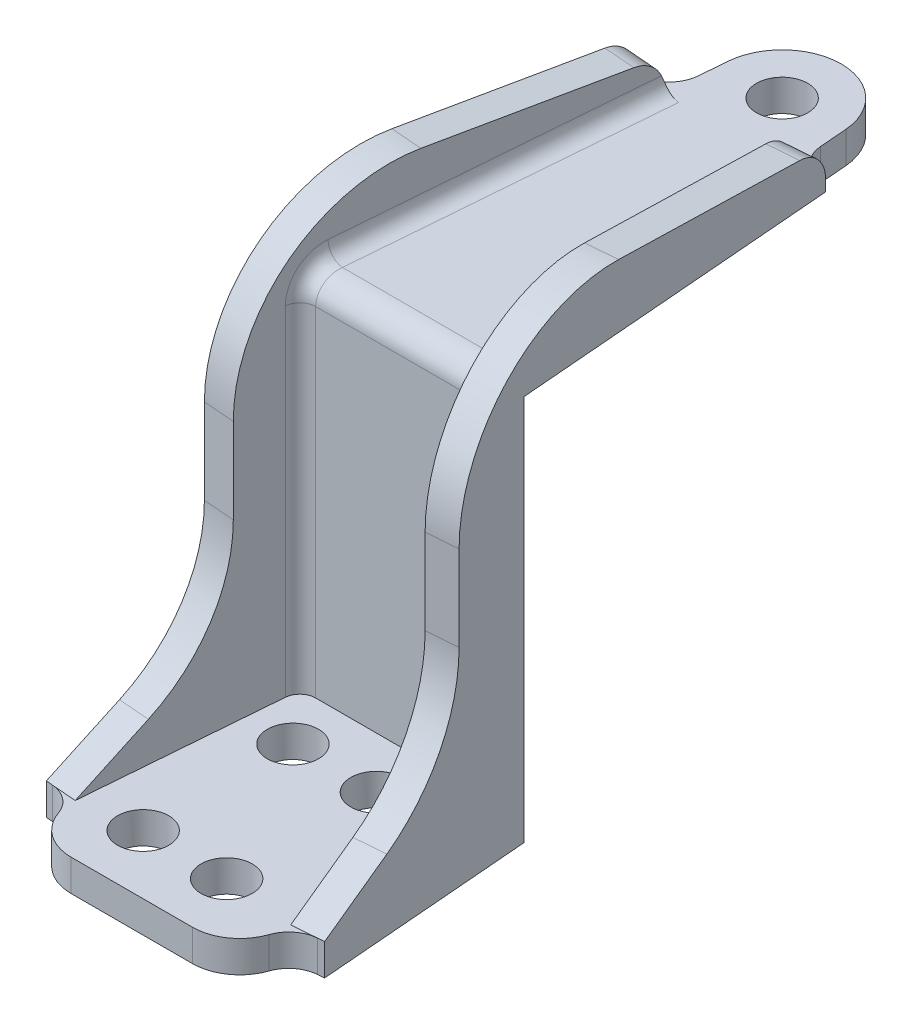
from build123d import *

# Parameters (mm, degrees)
EXTRUDE_THIN1_DEPTH = 15
SKETCH2_R           = 3.25
SKETCH2_R_2         = 3.250000000000001
SKETCH2_R_3         = 3.2500000000000004
CUT_EXTRUDE1_DEPTH  = 105.04326023342406
FILLET1_R           = 6
BOSS_EXTRUDE1_DEPTH = 4
FILLET2_R           = 4
FILLET3_R           = 2
CHAMFER1_SIZE       = 3


with BuildPart() as part:
    # Sketch1 → Extrude-Thin1 (new, symmetric)
    with BuildSketch(Plane(origin=(0, 0, 0), x_dir=(0, 0, -1), z_dir=(1, 0, 0))):
        with BuildLine():
            Line((-2.6e-16, 2), (-54, 1.9999999999999931))
            ThreePointArc((-53.99999999999915, 1.999999999999993), (-56.12132034355961, 1.121320343560103), (-56.99999999999909, -0.9999999999999665))
            Line((-56.99999999999999, -1.0000000000000062), (-56.999999999999986, -44))
            Line((-56.999999999999986, -44), (-90, -44.000000000000014))
            Line((-90, -44.000000000000014), (-90, -48.000000000000014))
            Line((-90, -48.000000000000014), (-55.99999999999999, -48))
            ThreePointArc((-55.999999999996966, -47.99999999999706), (-53.878679656439246, -47.12132034355912), (-52.999999999999986, -45.00000000000012))
            Line((-52.999999999999986, -45.00000000000001), (-52.99999999999999, -2.000000000000007))
            Line((-52.99999999999999, -2.000000000000007), (2.6e-16, -2))
            Line((2.6e-16, -2), (-2.6e-16, 2))
        make_face()
    extrude(amount=EXTRUDE_THIN1_DEPTH, both=True)

    # Sketch2 → Cut-Extrude1 (cut, through all)
    with BuildSketch(Plane(origin=(0, 2, 2.6e-16), x_dir=(1, 0, 0), z_dir=(0, 1, 1.2e-16))):
        with Locations(Location((0, -7.500000000000001, 0), (0, 0, 270))):
            Circle(SKETCH2_R)
        with Locations(Location((-6.061254587116736, -82.49999999999999, 0), (0, 0, 270))):
            Circle(SKETCH2_R_2)
        with Locations(Location((-6.061254587116736, -63.5, 0), (0, 0, 270))):
            Circle(SKETCH2_R_2)
        with Locations(Location((4.525736758380498, -82.49999999999999, 0), (0, 0, 270))):
            Circle(SKETCH2_R_3)
        with Locations(Location((4.525736758380496, -63.5, 0), (0, 0, 270))):
            Circle(SKETCH2_R_3)
        with BuildLine():
            Line((-7.475626789472967, -6.89584430440979), (-15, -100))
            Line((-15, -100), (-17.60021430999359, 8.448336275336032))
            Line((-17.60021430999359, 8.448336275336032), (38.42658286927368, 9.42947630958571))
            Line((38.42658286927368, 9.42947630958571), (15, -100))
            Line((15, -100), (7.475626789472967, -6.89584430440979))
            ThreePointArc((7.475626789472967, -6.89584430440979), (4.6e-16, -1.78e-15), (-7.475626789472967, -6.89584430440979))
        make_face()
    extrude(amount=-CUT_EXTRUDE1_DEPTH, mode=Mode.SUBTRACT)

    # Fillet1
    fillet1_edges = [part.edges().sort_by_distance(p)[0] for p in [
        (-14.19183272171777, -46.000000000000014, 90),
        (14.191832721717766, -46.000000000000014, 90),
    ]]
    fillet(fillet1_edges, radius=FILLET1_R)

    # Sketch8 → Boss-Extrude1 (add)
    with BuildSketch(Plane(origin=(6.873434455744054, 7e-17, -0.5554884816549988), x_dir=(-0.08055409274536145, 0, -0.9967502385963958), z_dir=(0.9967502385963958, 0, -0.08055409274536145))):
        with BuildLine():
            Line((-56.739879552269116, -48.000000000000014), (-84.3462691752867, -48.000000000000014))
            Line((-84.3462691752867, -48.000000000000014), (-84.3462691752867, -44.000000000000014))
            Line((-84.3462691752867, -44.000000000000014), (-75.73009848191336, -39.025451530797135))
            ThreePointArc((-75.73009848191336, -39.025451530797135), (-68.4095904062246, -31.70494345510837), (-65.73009848191339, -21.70494345510838))
            Line((-65.73009848191339, -21.70494345510838), (-65.73009848191336, -10.883213245781832))
            ThreePointArc((-65.73009848191336, -10.883213245781832), (-59.11411389020946, 3.9784196238086604), (-43.64328532686411, 9.007619086122059))
            Line((-43.64328532686411, 9.007619086122059), (-18.558264158463114, 6.3758663622832925))
            ThreePointArc((-18.558264158463114, 6.3758663622832925), (-16.00330021555487, 5.074502977561734), (-14.975626789472969, 2.397699895902515))
            Line((-14.975626789472969, 2.397699895902515), (-14.975626789472969, 1.9999999999999996))
            Line((-14.975626789472969, 1.9999999999999996), (-14.975626789472969, -2.000000000000003))
            Line((-14.975626789472969, -2.000000000000003), (-53.73009848191338, -2.000000000000007))
            Line((-53.73009848191338, -2.000000000000007), (-53.73009848191337, -45.00000000000001))
            add(Edge.make_bspline(
                [(-56.739879552269116, -48.000000000000014), (-53.73009848191338, -48.00000000000001), (-53.73009848191337, -45.00000000000001)],
                knots=[4.7123889803846915, 4.7123889803846915, 4.7123889803846915, 6.283185307179586, 6.283185307179586, 6.283185307179586], degree=2, weights=[1, 0.7071067811865481, 1]))
        make_face()
    boss_extrude1 = extrude(amount=BOSS_EXTRUDE1_DEPTH)

    # Mirror1: Boss-Extrude1 across plane
    add(boss_extrude1.mirror(Plane(origin=(0, 0, 0), x_dir=(0, 0, 1), z_dir=(1, 0, 0))))

    # Fillet2
    # the kernel refuses this fillet: 4 mm, written as the material it adds along each edge
    with BuildSketch(Plane(origin=(-8.079782485063179, -2.000000000000003, 14.371471093882759), x_dir=(-0.9967502385963957, 0, -0.08055409274536145), z_dir=(0, 1, 0))) as fillet2_piece_1:
        with BuildLine():
            CenterArc((FILLET2_R, -FILLET2_R), FILLET2_R, 90.00000000000001, 89.99999999999999)
            Line((-1.67e-15, -FILLET2_R), (0, 0))
            Line((0, 0), (FILLET2_R, -4e-17))
        make_face()
    extrude(amount=4.000000000000001)
    with BuildSketch(Plane(origin=(8.079782485063179, -2.000000000000003, 14.371471093882759), x_dir=(0.9967502385963957, 0, -0.08055409274536145), z_dir=(0, 1, 0))) as fillet2_piece_2:
        with BuildLine():
            CenterArc((FILLET2_R, FILLET2_R), FILLET2_R, 180.00000000000009, 89.99999999999989)
            Line((-2.09e-15, FILLET2_R), (0, 0))
            Line((0, 0), (FILLET2_R, 4e-17))
        make_face()
    extrude(amount=4.000000000000002)
    with BuildSketch(Plane(origin=(13.667871645615318, -48.00000000000001, 83.51667544352783), x_dir=(0.9967502385963959, 0, -0.08055409274535966), z_dir=(-1e-17, 1, 0))) as fillet2_piece_3_section:
        with BuildLine():
            CenterArc((3.165151389911689, -3.9999999999999964), FILLET2_R, 90.00000000000013, 66.4218215217981)
            ThreePointArc((-0.5009091660529862, -2.3999999999999995), (-0.12656212241577908, -1.2258578621353275), (0, 0))
            Line((0, 0), (3.16515138991168, 2e-17))
        make_face()
    fillet2_piece_3 = extrude(amount=4, mode=Mode.PRIVATE)
    fillet2_piece_3 = split(fillet2_piece_3, bisect_by=Plane(origin=(14.509633242445906, -44.745341237819986, 84.74382493773044), z_dir=(-0.04027704637268085, -0.8660254037844379, -0.4983751192981995)), keep=Keep.TOP, mode=Mode.PRIVATE)
    add(fillet2_piece_3)
    with BuildSketch(Plane(origin=(13.667871645615318, -48.00000000000001, 83.51667544352783), x_dir=(0.9967502385963959, 0, -0.08055409274535966), z_dir=(-1e-17, 1, 0))) as fillet2_piece_4_section:
        with BuildLine():
            CenterArc((3.165151389911689, -3.9999999999999964), FILLET2_R, 90.00000000000013, 66.4218215217981)
            ThreePointArc((-0.5009091660529862, -2.3999999999999995), (-0.12656212241577908, -1.2258578621353275), (0, 0))
            Line((0, 0), (3.16515138991168, 2e-17))
        make_face()
    fillet2_piece_4 = extrude(amount=4, mode=Mode.PRIVATE)
    fillet2_piece_4 = split(fillet2_piece_4, bisect_by=Plane(origin=(13.940749847793803, -44.53487315051496, 84.42407027652378), z_dir=(0.04027704637268085, 0.8660254037844379, 0.4983751192981995)), keep=Keep.TOP, mode=Mode.PRIVATE)
    add(fillet2_piece_4)
    with BuildSketch(Plane(origin=(-13.667871645615321, -44.00000000000001, 83.51667544352783), x_dir=(0.12479077617393508, 0, 0.9921830789637095), z_dir=(-1e-17, -1, 0))) as fillet2_piece_5_section:
        with BuildLine():
            CenterArc((3.268954299027519, 3.915625251722812), FILLET2_R, 191.7890892391009, 66.42182152179817)
            Line((-0.6466709526952895, 3.098386676965934), (0, 0))
            ThreePointArc((0, 0), (1.225857862135327, 0.1265621224157811), (2.4517157242706373, -2e-17))
        make_face()
    fillet2_piece_5 = extrude(amount=4.000000000000007, mode=Mode.PRIVATE)
    fillet2_piece_5 = split(fillet2_piece_5, bisect_by=Plane(origin=(-13.940749847793269, -44.53487315051504, 84.42407027652396), z_dir=(-0.04027704637268085, 0.8660254037844379, 0.4983751192981995)), keep=Keep.TOP, mode=Mode.PRIVATE)
    add(fillet2_piece_5)
    with BuildSketch(Plane(origin=(-13.667871645615321, -44.00000000000001, 83.51667544352783), x_dir=(0.12479077617393508, 0, 0.9921830789637095), z_dir=(-1e-17, -1, 0))) as fillet2_piece_6_section:
        with BuildLine():
            CenterArc((3.268954299027519, 3.915625251722812), FILLET2_R, 191.7890892391009, 66.42182152179817)
            Line((-0.6466709526952895, 3.098386676965934), (0, 0))
            ThreePointArc((0, 0), (1.225857862135327, 0.1265621224157811), (2.4517157242706373, -2e-17))
        make_face()
    fillet2_piece_6 = extrude(amount=4.000000000000007, mode=Mode.PRIVATE)
    fillet2_piece_6 = split(fillet2_piece_6, bisect_by=Plane(origin=(-14.509633242445908, -44.745341237819986, 84.74382493773044), z_dir=(0.04027704637268085, -0.8660254037844379, -0.4983751192981995)), keep=Keep.TOP, mode=Mode.PRIVATE)
    add(fillet2_piece_6)

    # Fillet3
    fillet3_edges = [part.edges().sort_by_distance(p)[0] for p in [
        (9.681106502482436, 1.9999999999999958, 34.18573554694116),
        (-9.681106502482438, 1.9999999999999958, 34.18573554694116),
        (-11.524880703386401, -22.499999999999993, 56.999999999999986),
        (11.5248807033864, -22.499999999999993, 56.999999999999986),
    ]]
    fillet(fillet3_edges, radius=FILLET3_R)

    # Chamfer1
    # the kernel refuses this chamfer: 3 mm, written as the material it takes off along each edge
    with BuildSketch(Plane(origin=(11.445304669675938, -2, 6.359277827353367), x_dir=(0.02740652157201868, 0.9996219169112968, -0.0022149053946040583), z_dir=(0.08055409274536145, 0, 0.9967502385963958))) as chamfer1_piece_1:
        Polygon((CHAMFER1_SIZE * 0.999621916911, CHAMFER1_SIZE * 0.0274958766106), (-CHAMFER1_SIZE * 0.0274958766106, CHAMFER1_SIZE * 0.999621916911), (0, 0), align=None)
    extrude(amount=46.469520656338155, mode=Mode.SUBTRACT)
    with BuildSketch(Plane(origin=(15.188614746459091, -2.000000000000007, 52.67778362901856), x_dir=(0.10793015817718699, 0, 0.9941584787929173), z_dir=(0, -1, -1.6e-16))) as chamfer1_piece_2:
        Polygon((CHAMFER1_SIZE * 0.999621916911, CHAMFER1_SIZE * 0.0274958766106), (-CHAMFER1_SIZE * 0.0274958766106, CHAMFER1_SIZE * 0.999621916911), (0, 0), align=None)
    extrude(amount=50.715048963897736, mode=Mode.SUBTRACT)
    with BuildSketch(Plane(origin=(-11.445304669675947, -2, 6.359277827353381), x_dir=(0.9963733841875214, -0.02749587661058638, 0.08052363660516859), z_dir=(-0.08055409274536145, 0, 0.9967502385963958))) as chamfer1_piece_3:
        Polygon((CHAMFER1_SIZE * 0.999621916911, CHAMFER1_SIZE * 0.0274958766106), (-CHAMFER1_SIZE * 0.0274958766106, CHAMFER1_SIZE * 0.999621916911), (0, 0), align=None)
    extrude(amount=46.46952065633815, mode=Mode.SUBTRACT)
    with BuildSketch(Plane(origin=(-15.188614746459098, -2.0000000000000075, 52.67778362901856), x_dir=(-0.10793015817718699, 0, 0.9941584787929173), z_dir=(0, -1, -1.6e-16))) as chamfer1_piece_4:
        Polygon((CHAMFER1_SIZE * 0.999621916911, -CHAMFER1_SIZE * 0.0274958766106), (-CHAMFER1_SIZE * 0.0274958766106, -CHAMFER1_SIZE * 0.999621916911), (0, 0), align=None)
    extrude(amount=50.715048963897736, mode=Mode.SUBTRACT)
    with BuildSketch(Plane(origin=(11.445304669675938, -2, 6.359277827353367), x_dir=(0.02740652157201868, 0.9996219169112968, -0.0022149053946040583), z_dir=(0.08055409274536145, 0, 0.9967502385963958))) as chamfer1_piece_5a_section:
        Polygon((CHAMFER1_SIZE * 0.999621916911, CHAMFER1_SIZE * 0.0274958766106), (-CHAMFER1_SIZE * 0.0274958766106, CHAMFER1_SIZE * 0.999621916911), (0, 0), align=None)
    chamfer1_piece_5a = extrude(amount=54.18456962023589, mode=Mode.PRIVATE)
    chamfer1_piece_5a = split(chamfer1_piece_5a, bisect_by=Plane(origin=(14.202449117839894, -1.010619119582221, 52.757482308220226), z_dir=(0.08055409274536145, 0, 0.9967502385963958)), keep=Keep.TOP, mode=Mode.PRIVATE)
    with BuildSketch(Plane(origin=(15.18861474645909, 5.715048963897733, 52.67778362901856), x_dir=(0.10793015817718754, 0, 0.9941584787929172), z_dir=(0, -1, -1.6e-16))) as chamfer1_piece_5b_section:
        Polygon((CHAMFER1_SIZE * 0.999621916911, CHAMFER1_SIZE * 0.0274958766106), (-CHAMFER1_SIZE * 0.0274958766106, CHAMFER1_SIZE * 0.999621916911), (0, 0), align=None)
    chamfer1_piece_5b = extrude(amount=58.43009792779548, mode=Mode.PRIVATE)
    chamfer1_piece_5b = split(chamfer1_piece_5b, bisect_by=Plane(origin=(14.28214779704156, -2, 53.743647936839395), z_dir=(0, 1, 0)), keep=Keep.TOP, mode=Mode.PRIVATE)
    chamfer1_piece_5 = chamfer1_piece_5a & chamfer1_piece_5b
    add(chamfer1_piece_5, mode=Mode.SUBTRACT)
    with BuildSketch(Plane(origin=(-11.445304669675947, -2, 6.359277827353381), x_dir=(0.9963733841875214, -0.02749587661058638, 0.08052363660516859), z_dir=(-0.08055409274536145, 0, 0.9967502385963958))) as chamfer1_piece_6a_section:
        Polygon((CHAMFER1_SIZE * 0.999621916911, CHAMFER1_SIZE * 0.0274958766106), (-CHAMFER1_SIZE * 0.0274958766106, CHAMFER1_SIZE * 0.999621916911), (0, 0), align=None)
    chamfer1_piece_6a = extrude(amount=54.184569620235884, mode=Mode.PRIVATE)
    chamfer1_piece_6a = split(chamfer1_piece_6a, bisect_by=Plane(origin=(-14.202449117840029, -1.0106191195820242, 52.75748230822022), z_dir=(-0.08055409274536145, 0, 0.9967502385963958)), keep=Keep.TOP, mode=Mode.PRIVATE)
    with BuildSketch(Plane(origin=(-15.188614746459097, 5.715048963897733, 52.67778362901856), x_dir=(-0.10793015817718754, 0, 0.9941584787929172), z_dir=(0, -1, -1.6e-16))) as chamfer1_piece_6b_section:
        Polygon((CHAMFER1_SIZE * 0.999621916911, -CHAMFER1_SIZE * 0.0274958766106), (-CHAMFER1_SIZE * 0.0274958766106, -CHAMFER1_SIZE * 0.999621916911), (0, 0), align=None)
    chamfer1_piece_6b = extrude(amount=58.43009792779548, mode=Mode.PRIVATE)
    chamfer1_piece_6b = split(chamfer1_piece_6b, bisect_by=Plane(origin=(-14.282147797041569, -2, 53.74364793683941), z_dir=(0, 1, 0)), keep=Keep.TOP, mode=Mode.PRIVATE)
    chamfer1_piece_6 = chamfer1_piece_6a & chamfer1_piece_6b
    add(chamfer1_piece_6, mode=Mode.SUBTRACT)


solid = part.part
